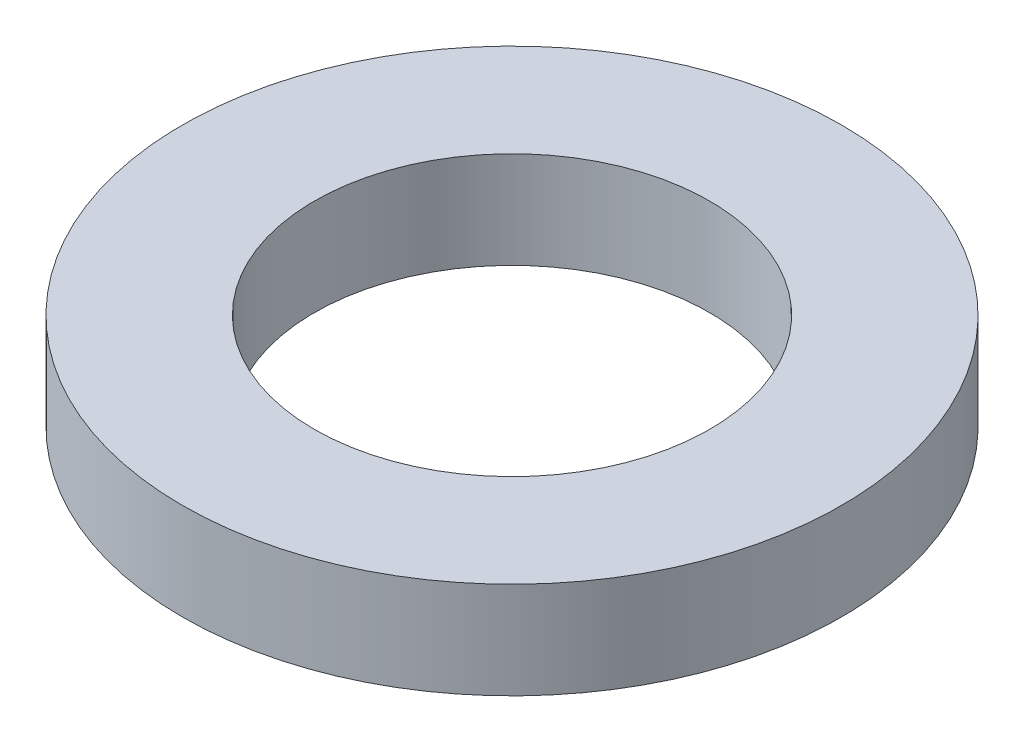
from build123d import *

# Parameters (mm, degrees)
SKETCH1_R           = 37.5
BOSS_EXTRUDE1_DEPTH = 11
SKETCH2_R           = 22.5
CUT_EXTRUDE1_DEPTH  = 55.161794653


with BuildPart() as part:
    # Sketch1 → Boss-Extrude1 (new body)
    with BuildSketch(Plane(origin=(0, 0, 0), x_dir=(1, 0, 0), z_dir=(0, 1, 0))):
        Circle(SKETCH1_R)
    extrude(amount=BOSS_EXTRUDE1_DEPTH)

    # Sketch2 → Cut-Extrude1 (cut, through all)
    with BuildSketch(Plane(origin=(0, 0, 0), x_dir=(1, 0, 0), z_dir=(0, 1, 0))):
        Circle(SKETCH2_R)
    extrude(amount=CUT_EXTRUDE1_DEPTH, mode=Mode.SUBTRACT)


solid = part.part
